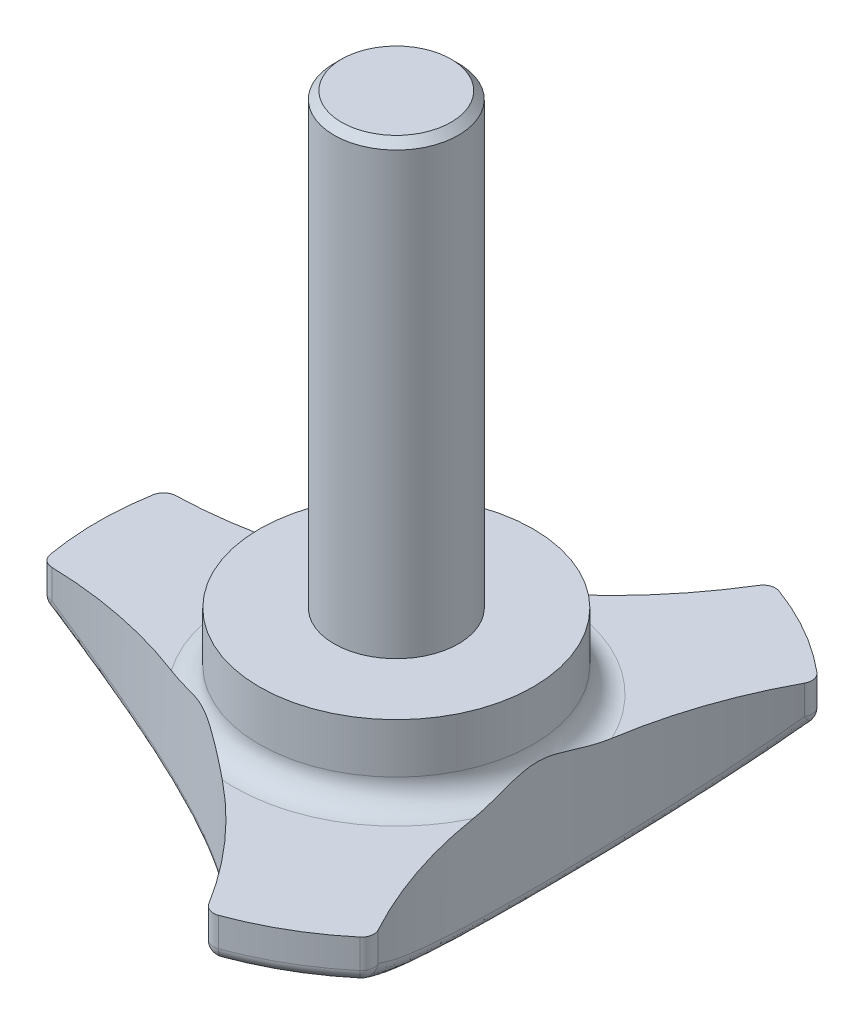
from build123d import *

# Parameters (mm, degrees)
SZKIC1_R                    = 12
DODANIE_WYCI_GNI_CIE1_DEPTH = 5
WYTNIJ_WYCI_GNI_CIE1_START  = -5
WYTNIJ_WYCI_GNI_CIE1_DEPTH  = 5
SZYK_KO_OWY1_COUNT          = 3
ZAOKR_GLENIE1_R             = 0.5
SZKIC4_R                    = 5.5
DODANIE_WYCI_GNI_CIE2_DEPTH = 3
SZKIC5_R                    = 2.5
DODANIE_WYCI_GNI_CIE3_DEPTH = 18
ZAOKR_GLENIE2_R             = 1
SFAZOWANIE1_SIZE            = 0.3


with BuildPart() as part:
    # Szkic1 → Dodanie-wyciągnięcie1 (new body)
    with BuildSketch(Plane(origin=(0, 0, 0), x_dir=(1, 0, 0), z_dir=(0, 1, 0))):
        with Locations(Location((0, 0, 0), (0, 0, 270))):
            Circle(SZKIC1_R)
    extrude(amount=DODANIE_WYCI_GNI_CIE1_DEPTH)

    # Szkic2 → Wytnij-wyciągnięcie1 (cut)
    with BuildSketch(Plane(origin=(0, 5, 0), x_dir=(1, 0, 0), z_dir=(0, 1, 0)).offset(WYTNIJ_WYCI_GNI_CIE1_START)):
        with BuildLine():
            ThreePointArc((-11.736670864, -2.500111405), (-5.986418703, -10.400134187), (3.732985364, -11.404596454))
            ThreePointArc((3.732985364, -11.404596454), (-2.820371946, -4.899798719), (-11.736670864, -2.500111405))
        make_face()
    wytnij_wyci_gni_cie1 = extrude(amount=WYTNIJ_WYCI_GNI_CIE1_DEPTH, mode=Mode.SUBTRACT)

    # Szyk kołowy1: Wytnij-wyciągnięcie1 ×3 about axis
    szyk_ko_owy1_axis = Axis((0, 0, 0), (0, 1, 0))
    for i in range(1, SZYK_KO_OWY1_COUNT):
        add(wytnij_wyci_gni_cie1.rotate(szyk_ko_owy1_axis, i * 360 / SZYK_KO_OWY1_COUNT), mode=Mode.SUBTRACT)

    # Szkic3 → Wycięcie-obrót2 (revolve, cut)
    with BuildSketch(Plane.XY, mode=Mode.PRIVATE) as wyci_cie_obr_t2_sk:
        with BuildLine():
            Line((0, 0), (0, -1))
            Line((0, -1), (-12, -1))
            Line((-12, -1), (-12, 3.560911085))
            ThreePointArc((-12, 3.560911085), (-6.258595844, 0.909007182), (0, 0))
        make_face()
    revolve(wyci_cie_obr_t2_sk.sketch.rotate(Axis((0, -5.338346039, 0), (0, 1, 0)), 180), axis=Axis((0, -5.338346039, 0), (0, 1, 0)), mode=Mode.SUBTRACT)

    # Zaokrąglenie1
    zaokr_glenie1_edges = [part.edges().sort_by_distance(p)[0] for p in [
        (3.703175443, 4.280455543, -11.414310826),
        (-11.743162931, 4.280455543, -2.469438069),
        (-2.833164191, 0.738827064, -4.892413113),
        (8.033495421, 4.280455543, 8.914199421),
        (8.010177567, 4.280455543, -8.935158384),
        (-11.736670864, 4.280455543, 2.500111405),
        (3.732985364, 4.280455543, 11.404596454),
        (6.013571057, 3.560911085, 10.384457768),
        (5.986418703, 3.560911085, -10.400134187),
        (-2.820371946, 0.738827064, 4.899798719),
        (6.315413129, 1.481143646, 4.805423076),
        (-11.99998976, 3.560911085, 0.015676419),
    ]]
    fillet(zaokr_glenie1_edges, radius=ZAOKR_GLENIE1_R)

    # Szkic4 → Dodanie-wyciągnięcie2 (add)
    with BuildSketch(Plane(origin=(0, 5, 0), x_dir=(1, 0, 0), z_dir=(0, 1, 0))):
        with Locations(Location((0, 0, 0), (0, 0, 270))):
            Circle(SZKIC4_R)
    extrude(amount=DODANIE_WYCI_GNI_CIE2_DEPTH)

    # Szkic5 → Dodanie-wyciągnięcie3 (add)
    with BuildSketch(Plane(origin=(0, 8, 0), x_dir=(1, 0, 0), z_dir=(0, 1, 0))):
        with Locations(Location((0, 0, 0), (0, 0, 270))):
            Circle(SZKIC5_R)
    extrude(amount=DODANIE_WYCI_GNI_CIE3_DEPTH)

    # Zaokrąglenie2
    # the kernel refuses this fillet: 1 mm, written as the material it adds along each edge
    with BuildSketch(Plane(origin=(0, 5, 0), x_dir=(0, 0, 1), z_dir=(-1, 0, 0))) as zaokr_glenie2_piece_1_section:
        with BuildLine():
            CenterArc((5.5 + ZAOKR_GLENIE2_R, ZAOKR_GLENIE2_R), ZAOKR_GLENIE2_R, 180, 90)
            Line((5.5, ZAOKR_GLENIE2_R), (5.5, 0))
            Line((5.5, 0), (5.5 + ZAOKR_GLENIE2_R, 0))
        make_face()
    zaokr_glenie2_piece_1 = revolve(axis=Axis((0, 5, 0), (0, 1, 0)), mode=Mode.PRIVATE)
    zaokr_glenie2_piece_1 = zaokr_glenie2_piece_1 - Plane(origin=(-11.8, 5.278674407, 20.5), x_dir=(0.8629436313514112, 0, -0.5053001970215725), z_dir=(0, -1, 0)) * Cylinder(18, 26, mode=Mode.PRIVATE)
    zaokr_glenie2_piece_1 = zaokr_glenie2_piece_1 - Plane(origin=(23.653520778, 5.278674407, -0.030900235), x_dir=(-0.8690746228336692, 0, -0.49468100827352957), z_dir=(0, -1, 0)) * Cylinder(18, 26, mode=Mode.PRIVATE)
    zaokr_glenie2_piece_1 = zaokr_glenie2_piece_1 - Plane(origin=(-11.853520778, 5.278674407, -20.469099765), x_dir=(0.006130991482257597, 0, 0.9999812052951018), z_dir=(0, -1, 0)) * Cylinder(18, 26, mode=Mode.PRIVATE)
    add(zaokr_glenie2_piece_1)

    # Sfazowanie1
    sfazowanie1_edges = [part.edges().sort_by_distance(p)[0] for p in [
        (0, 26, -2.5),
    ]]
    chamfer(sfazowanie1_edges, length=SFAZOWANIE1_SIZE)


solid = part.part
